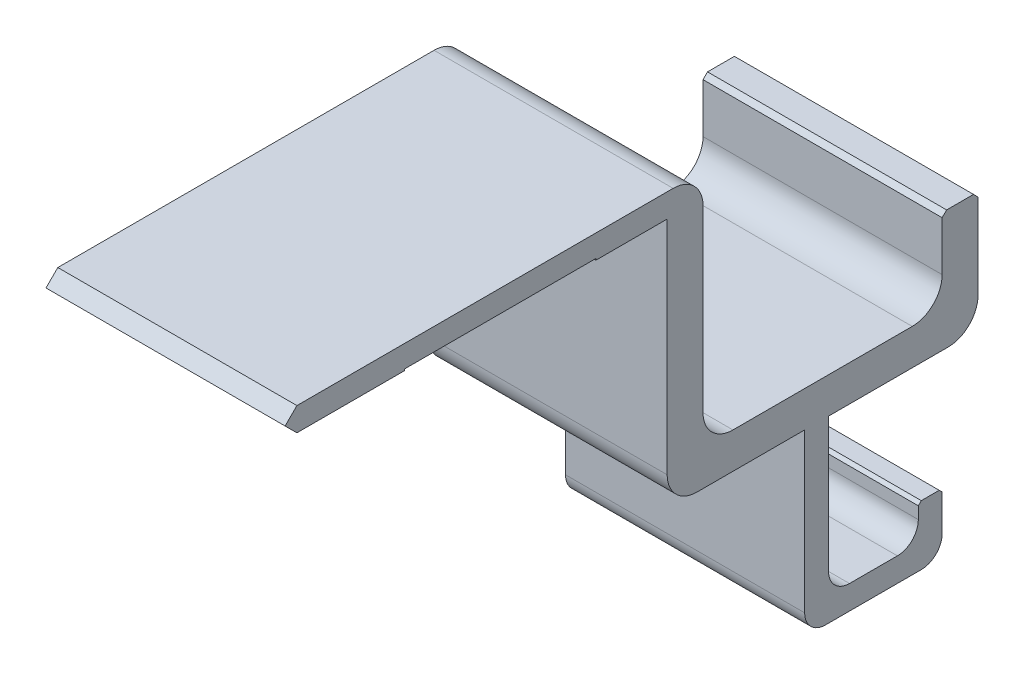
from build123d import *

# Parameters (mm, degrees)
BOSS_EXTRUDE1_DEPTH = 20
FILLET2_R           = 5
FILLET3_R           = 5
FILLET4_R           = 5
FILLET5_R           = 3.5
CHAMFER1_SIZE       = 2
CHAMFER2_SIZE       = 0.75
CHAMFER3_SIZE       = 0.5


with BuildPart() as part:
    # Sketch1 → Boss-Extrude1 (new, symmetric)
    with BuildSketch(Plane(origin=(0, 0, 0), x_dir=(0, 0, -1), z_dir=(1, 0, 0))):
        Polygon((-69.940788655, 0), (-15, 0), (0, 0), (0, -40), (40, -40), (40, -26), (46, -26), (46, -46), (-6, -46), (-6, -3.95), (-13.226857143, -3.95), (-17.940788655, -3.95), (-17.940788655, -3.7), (-49.940788655, -3.7), (-49.940788655, -3.95), (-69.940788655, -3.95), align=None)
        Polygon((21, -72), (21, -46), (17, -46), (17, -76), (40.014855678, -76), (40.014855678, -66), (36.014855678, -66), (36.014855678, -72), align=None)
    extrude(amount=BOSS_EXTRUDE1_DEPTH, both=True)

    # Fillet2
    fillet2_edges = [part.edges().sort_by_distance(p)[0] for p in [
        (0, 0, 0),
    ]]
    fillet(fillet2_edges, radius=FILLET2_R)

    # Fillet3
    fillet3_edges = [part.edges().sort_by_distance(p)[0] for p in [
        (0, -40, 0),
        (0, -40, -40),
    ]]
    fillet(fillet3_edges, radius=FILLET3_R)

    # Fillet4
    fillet4_edges = [part.edges().sort_by_distance(p)[0] for p in [
        (0, -46, -46),
        (0, -46, 6),
    ]]
    fillet(fillet4_edges, radius=FILLET4_R)

    # Fillet5
    fillet5_edges = [part.edges().sort_by_distance(p)[0] for p in [
        (0, -72, -21),
        (0, -72, -36.014855678),
        (0, -76, -40.014855678),
        (0, -76, -17),
    ]]
    fillet(fillet5_edges, radius=FILLET5_R)

    # Chamfer1
    # the kernel refuses this chamfer: 2 mm, written as the material it takes off along each edge
    with BuildSketch(Plane(origin=(-25.143365976, -3.95, 69.940788655), x_dir=(0, 0.9996219169112968, 0.027495876610589075), z_dir=(1, 0, 0)), Plane(origin=(-25.143365976, 0, 69.940788655), x_dir=(0, 0.02749587661058631, -0.9996219169112968), z_dir=(1, 0, 0))) as chamfer1_piece_1:
        Polygon((CHAMFER1_SIZE * 0.999621916911, -CHAMFER1_SIZE * 0.0274958766106), (-CHAMFER1_SIZE * 0.0274958766106, -CHAMFER1_SIZE * 0.999621916911), (0, 0), align=None)
    extrude(amount=50.286731952, mode=Mode.SUBTRACT)

    # Chamfer2
    chamfer2_edges = [part.edges().sort_by_distance(p)[0] for p in [
        (0, -26, -40),
        (0, -26, -46),
    ]]
    chamfer(chamfer2_edges, length=CHAMFER2_SIZE)

    # Chamfer3
    chamfer3_edges = [part.edges().sort_by_distance(p)[0] for p in [
        (0, -66, -36.014855678),
        (0, -66, -40.014855678),
    ]]
    chamfer(chamfer3_edges, length=CHAMFER3_SIZE)


solid = part.part
